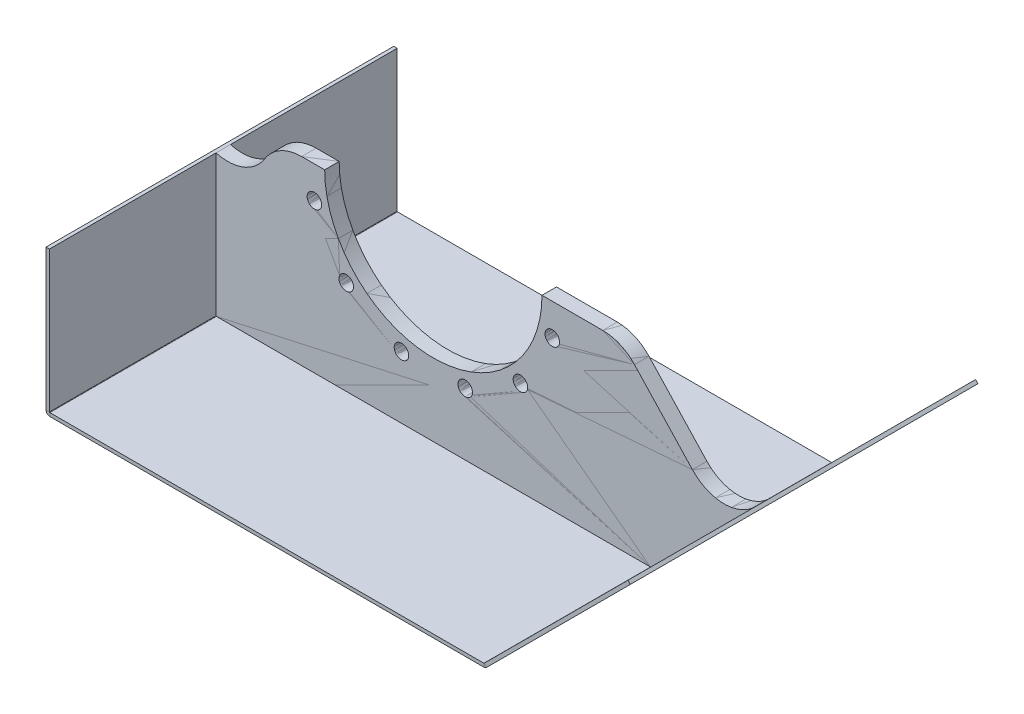
from build123d import *

# Parameters (mm, degrees)
SKETCH1_R                    = 241.3
SKETCH1_R_2                  = 190.5
SKETCH1_R_3                  = 12.7
BOSS_EXTRUDE1_DEPTH          = 25.4
SKETCH19_W                   = 762
SKETCH19_H                   = 609.6
BASE_FLANGE1_DEPTH           = 6
EDGE_FLANGE1_STRIP_CUT_DEPTH = 609.6
EDGE_FLANGE1_DEPTH           = 609.6
EDGE_FLANGE2_STRIP_W         = 25.4732
EDGE_FLANGE2_STRIP_H         = 6
EDGE_FLANGE2_STRIP_CUT_DEPTH = 609.6
EDGE_FLANGE2_DEPTH           = 609.6
BOSS_EXTRUDE2_DEPTH          = 12.7
BOSS_EXTRUDE2_DEPTH_BACK     = 12.7
FILLET1_R                    = 76.2
SKETCH30_R                   = 12.7
CUT_EXTRUDE1_DEPTH           = 783.174585068
FILLET3_R                    = 76.2
SKETCH31_R                   = 12.7
BOSS_EXTRUDE3_DEPTH          = 25.4


# Sheet-metal steps are written as plain solids
with BuildPart() as part:
    # Sketch1 → Boss-Extrude1 (new body)
    with BuildSketch(Plane.XY):
        Circle(SKETCH1_R)
        Circle(SKETCH1_R_2, mode=Mode.SUBTRACT)
        with Locations((55.879031838, 208.543385896)):
            Circle(SKETCH1_R_3, mode=Mode.SUBTRACT)
        with Locations((152.664354058, 152.664354058)):
            Circle(SKETCH1_R_3, mode=Mode.SUBTRACT)
        with Locations((208.543385896, 55.879031838)):
            Circle(SKETCH1_R_3, mode=Mode.SUBTRACT)
        with Locations((208.543385896, -55.879031838)):
            Circle(SKETCH1_R_3, mode=Mode.SUBTRACT)
        with Locations((152.664354058, -152.664354058)):
            Circle(SKETCH1_R_3, mode=Mode.SUBTRACT)
        with Locations((55.879031838, -208.543385896)):
            Circle(SKETCH1_R_3, mode=Mode.SUBTRACT)
        with Locations((-55.879031838, -208.543385896)):
            Circle(SKETCH1_R_3, mode=Mode.SUBTRACT)
        with Locations((-152.664354058, -152.664354058)):
            Circle(SKETCH1_R_3, mode=Mode.SUBTRACT)
        with Locations((-208.543385896, -55.879031838)):
            Circle(SKETCH1_R_3, mode=Mode.SUBTRACT)
        with Locations((-208.543385896, 55.879031838)):
            Circle(SKETCH1_R_3, mode=Mode.SUBTRACT)
        with Locations((-152.664354058, 152.664354058)):
            Circle(SKETCH1_R_3, mode=Mode.SUBTRACT)
        with Locations((-55.879031838, 208.543385896)):
            Circle(SKETCH1_R_3, mode=Mode.SUBTRACT)
    extrude(amount=BOSS_EXTRUDE1_DEPTH)



with BuildPart() as body_2:
    # Sketch19 → Base-Flange1 (new body)
    with BuildSketch(Plane(origin=(0, -317.5, 0), x_dir=(1, 0, 0), z_dir=(0, 1, 0))):
        with Locations((0, -12.7)):
            Rectangle(SKETCH19_W, SKETCH19_H)
    extrude(amount=-BASE_FLANGE1_DEPTH)

    # Edge-Flange1 strip (across the edge) → Edge-Flange1 strip cut (cut)
    with BuildSketch(Plane(origin=(381, -317.5, 317.5), x_dir=(-0.7071067811865438, 0.7071067811865512, 0), z_dir=(0, 0, -1))):
        Polygon((-22.039168001, 13.553886626), (-4.026895542, -4.458385832), (0.215745145, -0.215745145), (-17.796527314, 17.796527314), align=None)
    extrude(amount=EDGE_FLANGE1_STRIP_CUT_DEPTH, mode=Mode.SUBTRACT)

    # Edge-Flange1 section (across the edge) → Edge-Flange1 (add)
    with BuildSketch(Plane(origin=(381, -317.5, 317.5), x_dir=(-0.7071067811865438, 0.7071067811865512, 0), z_dir=(0, 0, -1))):
        with BuildLine():
            Line((-6, 0.30510971), (-6, 356.670718626))
            Line((-6, 356.670718626), (0, 356.670718626))
            Line((0, 356.670718626), (0, 0.30510971))
            ThreePointArc((0, 0.30510971), (0.056070336, 0.023225094), (0.215745145, -0.215745145))
            Line((0.215745145, -0.215745145), (-4.026895542, -4.458385832))
            ThreePointArc((-4.026895542, -4.458385832), (-5.487206859, -2.2728755), (-6, 0.30510971))
        make_face()
    extrude(amount=EDGE_FLANGE1_DEPTH)

    # Edge-Flange2 strip (across the edge) → Edge-Flange2 strip cut (cut)
    with BuildSketch(Plane(origin=(-381, -317.5, -292.1), x_dir=(1, 0, 0), z_dir=(0, 0, 1))):
        with Locations((-12, -3)):
            Rectangle(EDGE_FLANGE2_STRIP_W, EDGE_FLANGE2_STRIP_H)
    extrude(amount=EDGE_FLANGE2_STRIP_CUT_DEPTH, mode=Mode.SUBTRACT)

    # Edge-Flange2 section (across the edge) → Edge-Flange2 (add)
    with BuildSketch(Plane(origin=(-381, -317.5, -292.1), x_dir=(1, 0, 0), z_dir=(0, 0, 1))):
        with BuildLine():
            Line((-6, 0.7366), (-6, 248))
            Line((-6, 248), (0, 248))
            Line((0, 248), (0, 0.7366))
            ThreePointArc((0, 0.7366), (0.215745145, 0.215745145), (0.7366, 0))
            Line((0.7366, 0), (0.7366, -6))
            ThreePointArc((0.7366, -6), (-4.026895542, -4.026895542), (-6, 0.7366))
        make_face()
    extrude(amount=EDGE_FLANGE2_DEPTH)


with BuildPart() as part_1:
    add(part.part)

    add(body_2.part)  # Boss-Extrude2 merges body 2
    # Sketch2 → Boss-Extrude2 (add, two sides: drawn at the far end of the back side and taken through both)
    with BuildSketch(Plane(origin=(0, 0, 12.7), x_dir=(-1, 0, 0), z_dir=(0, 0, -1)).offset(-BOSS_EXTRUDE2_DEPTH_BACK)):
        with BuildLine():
            Line((-176.371629871, 164.677679655), (-508, -190.5))
            Line((-508, -190.5), (-381, -317.5))
            Line((-381, -317.5), (381, -317.5))
            Line((381, -317.5), (381, -190.5))
            Line((381, -190.5), (211.187529283, 116.728391899))
            ThreePointArc((211.187529283, 116.728391899), (-29.628031694, -239.474152547), (-176.371629871, 164.677679655))
        make_face()
    extrude(amount=BOSS_EXTRUDE2_DEPTH + BOSS_EXTRUDE2_DEPTH_BACK)

    # Fillet1
    # the kernel refuses this fillet: 76.2 mm, written as the material it adds along each edge
    with BuildSketch(Plane(origin=(-381, -190.5, 0), x_dir=(0, 1, 0), z_dir=(0, 0, 1))) as fillet1_piece_1:
        with BuildLine():
            CenterArc((194.419807723, -20.395387566), FILLET1_R, 164.475167034, 76.594355804)
            Line((157.558210281, -87.086186287), (156.820978332, -88.420002261))
            Line((156.820978332, -88.420002261), (-0.737231949, -1.333815974))
            Line((-0.737231949, -1.333815974), (0, 1.524))
            ThreePointArc((0, 1.524), (60.5, 1.524), (119.531603846, 0.407907751))
            Line((119.531603846, 0.407907751), (121, 0))
        make_face()
    extrude(amount=25.4)
    with BuildSketch(Plane(origin=(508, -190.5, 25.4), x_dir=(0.7071067811865509, 0.707106781186544, 0), z_dir=(0, 0, -1))) as fillet1_piece_2:
        with BuildLine():
            CenterArc((FILLET1_R * 1.03487581695, -FILLET1_R), FILLET1_R, 90, 91.963796982)
            Line((FILLET1_R * 0.0354631377737, -FILLET1_R * 1.03426801283), (FILLET1_R * 0.0154748841901, -FILLET1_R * 1.03495337309))
            Line((FILLET1_R * 0.0154748841901, -FILLET1_R * 1.03495337309), (-FILLET1_R * 0.020697516339, FILLET1_R * 0.02))
            Line((-FILLET1_R * 0.020697516339, FILLET1_R * 0.02), (FILLET1_R * 1.03487581695, FILLET1_R * 0.02))
            Line((FILLET1_R * 1.03487581695, FILLET1_R * 0.02), (FILLET1_R * 1.03487581695, 0))
        make_face()
    extrude(amount=25.4)

    # Sketch30 → Cut-Extrude1 (cut, through all)
    # profile 1 of 3: a face of its own
    with BuildSketch(Plane(origin=(0, 0, 0), x_dir=(-1, 0, 0), z_dir=(0, 0, -1))):
        with BuildLine():
            Line((-330.130702101, 0), (-241.3, 0))
            ThreePointArc((-241.3, 0), (-224.481808047, 88.507671171), (-176.371629871, 164.677679655))
            Line((-176.371629871, 164.677679655), (-330.130702101, 0))
        make_face()
    # profile 2 of 3: a face of its own
    with BuildSketch(Plane(origin=(0, 0, 0), x_dir=(-1, 0, 0), z_dir=(0, 0, -1))):
        with BuildLine():
            Line((-241.3, 0), (-190.5, 0))
            ThreePointArc((-190.5, 0), (0, 190.5), (190.5, 0))
            Line((190.5, 0), (241.3, 0))
            ThreePointArc((241.3, 0), (233.650637508, 60.274949954), (211.187529283, 116.728391899))
            ThreePointArc((211.187529283, 116.728391899), (29.628031694, 239.474152547), (-176.371629871, 164.677679655))
            ThreePointArc((-176.371629871, 164.677679655), (-224.481808047, 88.507671171), (-241.3, 0))
        make_face()
        with Locations((-208.543385896, 55.879031838)):
            Circle(SKETCH30_R, mode=Mode.SUBTRACT)
        with Locations((-152.664354058, 152.664354058)):
            Circle(SKETCH30_R, mode=Mode.SUBTRACT)
        with Locations((-55.879031838, 208.543385896)):
            Circle(SKETCH30_R, mode=Mode.SUBTRACT)
        with Locations((208.543385896, 55.879031838)):
            Circle(SKETCH30_R, mode=Mode.SUBTRACT)
        with Locations((55.879031838, 208.543385896)):
            Circle(SKETCH30_R, mode=Mode.SUBTRACT)
        with Locations((152.664354058, 152.664354058)):
            Circle(SKETCH30_R, mode=Mode.SUBTRACT)
    # profile 3 of 3: a face of its own
    with BuildSketch(Plane(origin=(0, 0, 0), x_dir=(-1, 0, 0), z_dir=(0, 0, -1))):
        with BuildLine():
            ThreePointArc((211.187529283, 116.728391899), (233.650637508, 60.274949954), (241.3, 0))
            Line((241.3, 0), (275.706099682, 0))
            Line((275.706099682, 0), (211.187529283, 116.728391899))
        make_face()
    extrude(amount=-CUT_EXTRUDE1_DEPTH, mode=Mode.SUBTRACT)

    # Fillet3
    fillet3_edges = [part_1.edges().sort_by_distance(p)[0] for p in [
        (-275.706099682, 0, 12.7),
        (330.130702101, 0, 12.7),
    ]]
    fillet(fillet3_edges, radius=FILLET3_R)


with BuildPart() as body_2_2:
    # Sketch31 → Boss-Extrude3 (new body)
    with BuildSketch(Plane.XY.offset(25.4)):
        with BuildLine():
            Line((-190.5, 0), (-230.964431894, 0))
            ThreePointArc((-230.964431894, 0), (-268.071542572, -9.645493488), (-295.784522164, -36.140096139))
            ThreePointArc((-295.784522164, -36.140096139), (-332.826755263, -67.036732857), (-381, -69.5))
            Line((-381, -69.5), (-381, -316.7634))
            ThreePointArc((-381, -316.7634), (-380.784254855, -317.284254855), (-380.2634, -317.5))
            Line((-380.2634, -317.5), (380.69489029, -317.5))
            ThreePointArc((380.69489029, -317.5), (380.976774906, -317.443929664), (381.215745145, -317.284254855))
            Line((381.215745145, -317.284254855), (563.760699338, -134.739300662))
            ThreePointArc((563.760699338, -134.739300662), (508.573359578, -157.046574652), (454.182858442, -132.861241721))
            Line((454.182858442, -132.861241721), (352.722924767, -24.196522214))
            ThreePointArc((352.722924767, -24.196522214), (327.389220887, -6.31042636), (297.026620597, 0))
            Line((297.026620597, 0), (190.5, 0))
            ThreePointArc((190.5, 0), (0, -190.5), (-190.5, 0))
        make_face()
        with Locations((208.543385896, -55.879031838)):
            Circle(SKETCH31_R, mode=Mode.SUBTRACT)
        with Locations((152.664354058, -152.664354058)):
            Circle(SKETCH31_R, mode=Mode.SUBTRACT)
        with Locations((55.879031838, -208.543385896)):
            Circle(SKETCH31_R, mode=Mode.SUBTRACT)
        with Locations((-55.879031838, -208.543385896)):
            Circle(SKETCH31_R, mode=Mode.SUBTRACT)
        with Locations((-152.664354058, -152.664354058)):
            Circle(SKETCH31_R, mode=Mode.SUBTRACT)
        with Locations((-208.543385896, -55.879031838)):
            Circle(SKETCH31_R, mode=Mode.SUBTRACT)
    extrude(amount=-BOSS_EXTRUDE3_DEPTH)


solid = Compound([part_1.part, body_2_2.part])
